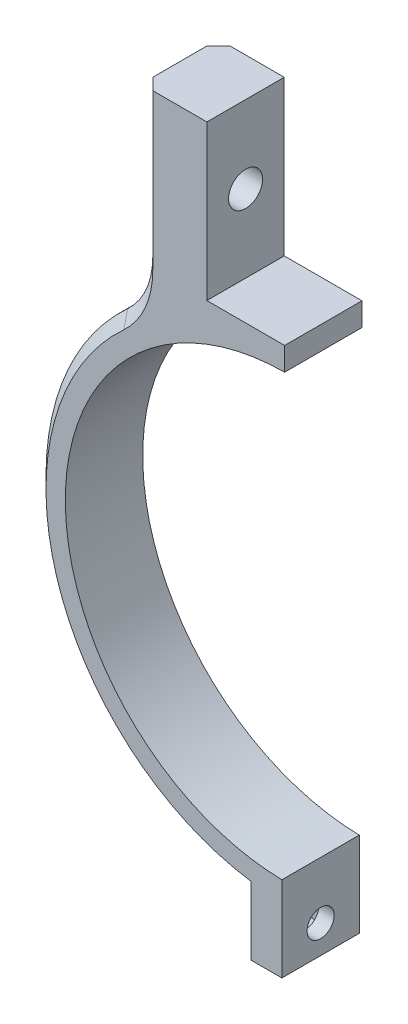
from build123d import *

# Parameters (mm, degrees)
AUFSATZ_LINEAR_AUSTRAGEN1_DEPTH = 10
SKIZZE2_R                       = 1.75
SCHNITT_LINEAR_AUSTRAGEN1_DEPTH = 65.196962545
SKIZZE4_R                       = 2.2
SCHNITT_LINEAR_AUSTRAGEN3_DEPTH = 74.305456823
VERRUNDUNG1_R                   = 10
SKIZZE5_W                       = 5.5
SKIZZE5_H                       = 5.5
SCHNITT_LINEAR_AUSTRAGEN4_DEPTH = 2
FASE1_SIZE                      = 1.5
SCHNITT_LINEAR_AUSTRAGEN5_DEPTH = 62.713045622


with BuildPart() as part:
    # Skizze1 → Aufsatz-Linear austragen1 (new body)
    with BuildSketch(Plane.XY):
        with BuildLine():
            Line((0.5, -28.495613698), (0.5, -32.496153619))
            Line((0.5, -32.496153619), (0.5, -39.496153619))
            Line((0.5, -39.496153619), (4.5, -39.496153619))
            Line((4.5, -39.496153619), (4.5, -32.186953879))
            ThreePointArc((4.5, -32.186953879), (31.590882714, -7.633225356), (18.7, 26.581196361))
            Line((18.7, 26.581196361), (18.7, 51.5))
            Line((18.7, 51.5), (10.2, 51.5))
            Line((10.2, 51.5), (10.2, 31.5))
            Line((10.2, 31.5), (-10.2, 31.5))
            Line((-10.2, 31.5), (-10.2, 51.5))
            Line((-10.2, 51.5), (-18.7, 51.5))
            Line((-18.7, 51.5), (-18.7, 26.581196361))
            ThreePointArc((-18.7, 26.581196361), (-31.590882714, -7.633225356), (-4.5, -32.186953879))
            Line((-4.5, -32.186953879), (-4.5, -39.496153619))
            Line((-4.5, -39.496153619), (-0.5, -39.496153619))
            Line((-0.5, -39.496153619), (-0.5, -32.496153619))
            Line((-0.5, -32.496153619), (-0.5, -28.495613698))
            ThreePointArc((-0.5, -28.495613698), (0, 28.5), (0.5, -28.495613698))
        make_face()
    extrude(amount=AUFSATZ_LINEAR_AUSTRAGEN1_DEPTH)

    # Skizze2 → Schnitt-Linear austragen1 (cut, through all)
    with BuildSketch(Plane.ZY.offset(4.5)):
        with Locations((5, -35.841553749)):
            Circle(SKIZZE2_R)
    extrude(amount=-SCHNITT_LINEAR_AUSTRAGEN1_DEPTH, mode=Mode.SUBTRACT)

    # Skizze4 → Schnitt-Linear austragen3 (cut, through all)
    with BuildSketch(Plane.ZY.offset(18.7)):
        with Locations((5, 41.5)):
            Circle(SKIZZE4_R)
    extrude(amount=-SCHNITT_LINEAR_AUSTRAGEN3_DEPTH, mode=Mode.SUBTRACT)

    # Verrundung1
    verrundung1_edges = [part.edges().sort_by_distance(p)[0] for p in [
        (18.7, 26.581196361, 5),
        (-18.7, 26.581196361, 5),
    ]]
    fillet(verrundung1_edges, radius=VERRUNDUNG1_R)

    # Skizze5 → Schnitt-Linear austragen4 (cut)
    with BuildSketch(Plane.ZY.offset(4.5)):
        with Locations((5, -35.841553749)):
            Rectangle(SKIZZE5_W, SKIZZE5_H)
    extrude(amount=-SCHNITT_LINEAR_AUSTRAGEN4_DEPTH, mode=Mode.SUBTRACT)

    # Fase1
    fase1_edges = [part.edges().sort_by_distance(p)[0] for p in [
        (-18.7, 41.422906559, 0),
        (-19.547693958, 27.316508696, 0),
        (-31.036620275, -9.642520517, 0),
        (18.7, 41.422906559, 0),
        (19.547693958, 27.316508696, 0),
        (31.036620275, -9.642520517, 0),
        (-18.7, 41.422906559, 10),
        (-19.547693958, 27.316508696, 10),
        (-31.036620275, -9.642520517, 10),
        (18.7, 41.422906559, 10),
        (19.547693958, 27.316508696, 10),
        (31.036620275, -9.642520517, 10),
    ]]
    chamfer(fase1_edges, length=FASE1_SIZE)

    # Skizze6 → Schnitt-Linear austragen5 (cut, through all)
    with BuildSketch(Plane.XY):
        Polygon((0, -80.065943577), (0, 27.478555263), (-0.15, 27.478555263), (-0.15, 32.428870792), (0, 32.428870792), (0, 80.065943577), (51.694887104, 80.065943577), (51.694887104, -72.979708266), align=None)
    extrude(amount=SCHNITT_LINEAR_AUSTRAGEN5_DEPTH, mode=Mode.SUBTRACT)


solid = part.part
